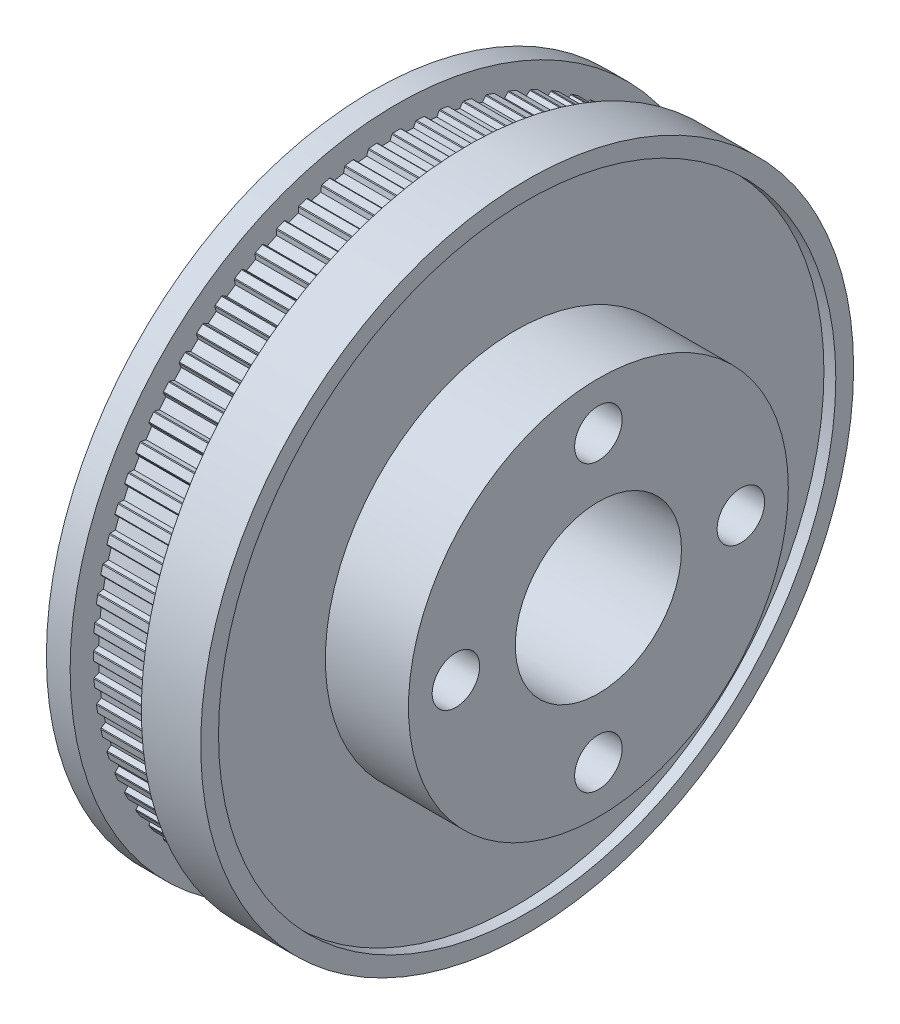
from build123d import *

# Parameters (mm, degrees)
RESSALTO_EXTRUS_O1_DEPTH = 6
SKETCH1_R                = 27.5
BOSS_EXTRUDE1_DEPTH      = 2
BOSS_EXTRUDE2_START      = 5
SKETCH2_R                = 27.5
BOSS_EXTRUDE2_DEPTH      = 5
SKETCH3_R                = 26
CUT_EXTRUDE4_DEPTH       = 1
SKETCH7_R                = 16
BOSS_EXTRUDE4_DEPTH      = 7
SKETCH5_R                = 2
CUT_EXTRUDE2_DEPTH       = 42.006097108
CIRPATTERN1_COUNT        = 4
SKETCH8_R                = 7
CUT_EXTRUDE5_DEPTH       = 44.283946216


with BuildPart() as part:
    # Esboço2 → Ressalto-extrusão1 (new body)
    with BuildSketch(Plane(origin=(0, 0, 0), x_dir=(0, 0, -1), z_dir=(1, 0, 0))):
        with BuildLine():
            ThreePointArc((0.33567243, 25.542794464), (0.167839838, 25.54444861), (0, 25.545))
            ThreePointArc((0, 25.545), (-0.165291878, 25.544465224), (-0.330576835, 25.54286092))
            Line((-0.330576835, 25.54286092), (-0.394918285, 25.498131943))
            Line((-0.394918285, 25.498131943), (-0.545457785, 25.093070513))
            Line((-0.545457785, 25.093070513), (-1.419487303, 25.057354241))
            Line((-1.419487303, 25.057354241), (-1.601874904, 25.450906938))
            Line((-1.601874904, 25.450906938), (-1.672762577, 25.492340818))
            Line((-1.672762577, 25.492340818), (-2.330728018, 25.440557814))
            Line((-2.330728018, 25.440557814), (-2.394261259, 25.38854478))
            Line((-2.394261259, 25.38854478), (-2.512555942, 24.972920826))
            Line((-2.512555942, 24.972920826), (-3.381088853, 24.868739091))
            Line((-3.381088853, 24.868739091), (-3.593792003, 25.24676863))
            Line((-3.593792003, 25.24676863), (-3.667712017, 25.282512999))
            Line((-3.667712017, 25.282512999), (-4.319586322, 25.179266252))
            Line((-4.319586322, 25.179266252), (-4.378842816, 25.122428796))
            Line((-4.378842816, 25.122428796), (-4.464163356, 24.698804779))
            Line((-4.464163356, 24.698804779), (-5.321844865, 24.526799893))
            Line((-5.321844865, 24.526799893), (-5.563552178, 24.886975597))
            Line((-5.563552178, 24.886975597), (-5.640048793, 24.916810081))
            Line((-5.640048793, 24.916810081), (-6.28181294, 24.762736141))
            Line((-6.28181294, 24.762736141), (-6.336427351, 24.701424684))
            Line((-6.336427351, 24.701424684), (-6.388247719, 24.272412386))
            Line((-6.388247719, 24.272412386), (-7.229789934, 24.033644819))
            Line((-7.229789934, 24.033644819), (-7.499011204, 24.373746084))
            Line((-7.499011204, 24.373746084), (-7.577612792, 24.397486743))
            Line((-7.577612792, 24.397486743), (-8.205310093, 24.193535527))
            Line((-8.205310093, 24.193535527), (-8.254945704, 24.128128076))
            Line((-8.254945704, 24.128128076), (-8.27294641, 23.6963725))
            Line((-8.27294641, 23.6963725), (-9.093160944, 23.392314332))
            Line((-9.093160944, 23.392314332), (-9.388236332, 23.710244321))
            Line((-9.388236332, 23.710244321), (-9.468458288, 23.727744786))
            Line((-9.468458288, 23.727744786), (-10.07821878, 23.475173721))
            Line((-10.07821878, 23.475173721), (-10.122569571, 23.406073534))
            Line((-10.122569571, 23.406073534), (-10.106639636, 22.974236597))
            Line((-10.106639636, 22.974236597), (-10.900469593, 22.606762449))
            Line((-10.900469593, 22.606762449), (-11.219579862, 22.900561018))
            Line((-11.219579862, 22.900561018), (-11.300927591, 22.911713393))
            Line((-11.300927591, 22.911713393), (-11.888991897, 22.612079663))
            Line((-11.888991897, 22.612079663), (-11.927784432, 22.539712766))
            Line((-11.927784432, 22.539712766), (-11.878022067, 22.110456887))
            Line((-11.878022067, 22.110456887), (-12.640573222, 21.681832358))
            Line((-12.640573222, 21.681832358), (-12.981750951, 21.94968814))
            Line((-12.981750951, 21.94968814), (-13.063722917, 21.954423667))
            Line((-13.063722917, 21.954423667), (-13.626465426, 21.609574614))
            Line((-13.626465426, 21.609574614), (-13.659460535, 21.534387173))
            Line((-13.659460535, 21.534387173), (-13.576172543, 21.110358857))
            Line((-13.576172543, 21.110358857), (-14.302743514, 20.62322656))
            Line((-14.302743514, 20.62322656), (-14.663885228, 20.863488136))
            Line((-14.663885228, 20.863488136), (-14.745976047, 20.861777619))
            Line((-14.745976047, 20.861777619), (-15.279927264, 20.473839352))
            Line((-15.279927264, 20.473839352), (-15.306921521, 20.396294922))
            Line((-15.306921521, 20.396294922), (-15.1906214, 19.980108444))
            Line((-15.1906214, 19.980108444), (-15.876732636, 19.437471713))
            Line((-15.876732636, 19.437471713), (-16.255611776, 19.648657791))
            Line((-16.255611776, 19.648657791), (-16.337315332, 19.640511774))
            Line((-16.337315332, 19.640511774), (-16.839183269, 19.211876062))
            Line((-16.839183269, 19.211876062), (-16.860010246, 19.132452731))
            Line((-16.860010246, 19.132452731), (-16.711415025, 18.72667402))
            Line((-16.711415025, 18.72667402), (-17.352836422, 18.131878389))
            Line((-17.352836422, 18.131878389), (-17.747117073, 18.312686936))
            Line((-17.747117073, 18.312686936), (-17.827929634, 18.298155644))
            Line((-17.827929634, 18.298155644), (-18.29462011, 17.831465168))
            Line((-18.29462011, 17.831465168), (-18.309151402, 17.750652607))
            Line((-18.309151402, 17.750652607), (-18.129177219, 17.357783422))
            Line((-18.129177219, 17.357783422), (-18.721954201, 16.714496005))
            Line((-18.721954201, 16.714496005), (-19.129205491, 16.863812276))
            Line((-19.129205491, 16.863812276), (-19.208628822, 16.842985299))
            Line((-19.208628822, 16.842985299), (-19.637264534, 16.341117361))
            Line((-19.637264534, 16.341117361), (-19.64541055, 16.259413806))
            Line((-19.64541055, 16.259413806), (-19.435167007, 15.881876318))
            Line((-19.435167007, 15.881876318), (-19.975644906, 15.194063195))
            Line((-19.975644906, 15.194063195), (-20.393355996, 15.310966606))
            Line((-20.393355996, 15.310966606), (-20.470900426, 15.283972349))
            Line((-20.470900426, 15.283972349), (-20.858838692, 14.750021132))
            Line((-20.858838692, 14.750021132), (-20.86054921, 14.667930313))
            Line((-20.86054921, 14.667930313), (-20.621332528, 14.308052165))
            Line((-20.621332528, 14.308052165), (-21.106179118, 13.579953933))
            Line((-21.106179118, 13.579953933), (-21.53177468, 13.663723735))
            Line((-21.53177468, 13.663723735), (-21.606962121, 13.630728626))
            Line((-21.606962121, 13.630728626), (-21.951811174, 13.067986118))
            Line((-21.951811174, 13.067986118), (-21.947075647, 12.986014151))
            Line((-21.947075647, 12.986014151), (-21.680360676, 12.646014112))
            Line((-21.680360676, 12.646014112), (-22.106586717, 11.882119739))
            Line((-22.106586717, 11.882119739), (-22.537442813, 11.932239464))
            Line((-22.537442813, 11.932239464), (-22.60980971, 11.89344693))
            Line((-22.60980971, 11.89344693), (-22.90944344, 11.305382624))
            Line((-22.90944344, 11.305382624), (-22.898291065, 11.224034894))
            Line((-22.898291065, 11.224034894), (-22.605722191, 10.906009177))
            Line((-22.605722191, 10.906009177), (-22.970699858, 10.111028326))
            Line((-22.970699858, 10.111028326), (-23.404160117, 10.127188969))
            Line((-23.404160117, 10.127188969), (-23.473260304, 10.082838178))
            Line((-23.473260304, 10.082838178), (-23.725831369, 9.473077686))
            Line((-23.725831369, 9.473077686), (-23.708330904, 9.39285573))
            Line((-23.708330904, 9.39285573), (-23.391711912, 9.098765069))
            Line((-23.391711912, 9.098765069), (-23.693190996, 8.277599061))
            Line((-23.693190996, 8.277599061), (-24.126582991, 8.259700986))
            Line((-24.126582991, 8.259700986), (-24.191990442, 8.210065375))
            Line((-24.191990442, 8.210065375), (-24.395941658, 7.582368074))
            Line((-24.395941658, 7.582368074), (-24.372200999, 7.503766487))
            Line((-24.372200999, 7.503766487), (-24.03348395, 7.235424049))
            Line((-24.03348395, 7.235424049), (-24.269605732, 6.393135645))
            Line((-24.269605732, 6.393135645), (-24.700257458, 6.3412892))
            Line((-24.700257458, 6.3412892), (-24.761568914, 6.28667479))
            Line((-24.761568914, 6.28667479), (-24.915642854, 5.644910642))
            Line((-24.915642854, 5.644910642), (-24.88580837, 5.568414027))
            Line((-24.88580837, 5.568414027), (-24.527081568, 5.327474233))
            Line((-24.527081568, 5.327474233), (-24.696390279, 4.469256422))
            Line((-24.696390279, 4.469256422), (-25.121646624, 4.383781257))
            Line((-25.121646624, 4.383781257), (-25.17848408, 4.324524764))
            Line((-25.17848408, 4.324524764), (-25.281730827, 3.672650459))
            Line((-25.281730827, 3.672650459), (-25.245986457, 3.598730444))
            Line((-25.245986457, 3.598730444), (-24.869461572, 3.386678768))
            Line((-24.869461572, 3.386678768), (-24.970913367, 2.517822747))
            Line((-24.970913367, 2.517822747), (-25.388152484, 2.399245846))
            Line((-25.388152484, 2.399245846), (-25.440165519, 2.335712604))
            Line((-25.440165519, 2.335712604), (-25.491948522, 1.677747164))
            Line((-25.491948522, 1.677747164), (-25.450514643, 1.606859491))
            Line((-25.450514643, 1.606859491), (-25.058513075, 1.425003301))
            Line((-25.058513075, 1.425003301), (-25.091482471, 0.550865858))
            Line((-25.091482471, 0.550865858), (-25.498131943, 0.399918285))
            Line((-25.498131943, 0.399918285), (-25.544999878, 0.3325))
            Line((-25.544999878, 0.3325), (-25.544999878, -0.3275))
            Line((-25.544999878, -0.3275), (-25.498131943, -0.394918285))
            Line((-25.498131943, -0.394918285), (-25.093070513, -0.545457785))
            Line((-25.093070513, -0.545457785), (-25.057354241, -1.419487303))
            Line((-25.057354241, -1.419487303), (-25.450906938, -1.601874904))
            Line((-25.450906938, -1.601874904), (-25.492340818, -1.672762577))
            Line((-25.492340818, -1.672762577), (-25.440557814, -2.330728018))
            Line((-25.440557814, -2.330728018), (-25.38854478, -2.394261259))
            Line((-25.38854478, -2.394261259), (-24.972920826, -2.512555942))
            Line((-24.972920826, -2.512555942), (-24.868739091, -3.381088853))
            Line((-24.868739091, -3.381088853), (-25.24676863, -3.593792003))
            Line((-25.24676863, -3.593792003), (-25.282512999, -3.667712017))
            Line((-25.282512999, -3.667712017), (-25.179266252, -4.319586322))
            Line((-25.179266252, -4.319586322), (-25.122428796, -4.378842816))
            Line((-25.122428796, -4.378842816), (-24.698804779, -4.464163356))
            Line((-24.698804779, -4.464163356), (-24.526799893, -5.321844865))
            Line((-24.526799893, -5.321844865), (-24.886975597, -5.563552178))
            Line((-24.886975597, -5.563552178), (-24.916810081, -5.640048793))
            Line((-24.916810081, -5.640048793), (-24.762736141, -6.28181294))
            Line((-24.762736141, -6.28181294), (-24.701424684, -6.336427351))
            Line((-24.701424684, -6.336427351), (-24.272412386, -6.388247719))
            Line((-24.272412386, -6.388247719), (-24.033644819, -7.229789934))
            Line((-24.033644819, -7.229789934), (-24.373746084, -7.499011204))
            Line((-24.373746084, -7.499011204), (-24.397486743, -7.577612792))
            Line((-24.397486743, -7.577612792), (-24.193535527, -8.205310093))
            Line((-24.193535527, -8.205310093), (-24.128128076, -8.254945704))
            Line((-24.128128076, -8.254945704), (-23.6963725, -8.27294641))
            Line((-23.6963725, -8.27294641), (-23.392314332, -9.093160944))
            Line((-23.392314332, -9.093160944), (-23.710244321, -9.388236332))
            Line((-23.710244321, -9.388236332), (-23.727744786, -9.468458288))
            Line((-23.727744786, -9.468458288), (-23.475173721, -10.07821878))
            Line((-23.475173721, -10.07821878), (-23.406073534, -10.122569571))
            Line((-23.406073534, -10.122569571), (-22.974236597, -10.106639636))
            Line((-22.974236597, -10.106639636), (-22.606762449, -10.900469593))
            Line((-22.606762449, -10.900469593), (-22.900561018, -11.219579862))
            Line((-22.900561018, -11.219579862), (-22.911713393, -11.300927591))
            Line((-22.911713393, -11.300927591), (-22.612079663, -11.888991897))
            Line((-22.612079663, -11.888991897), (-22.539712766, -11.927784432))
            Line((-22.539712766, -11.927784432), (-22.110456887, -11.878022067))
            Line((-22.110456887, -11.878022067), (-21.681832358, -12.640573222))
            Line((-21.681832358, -12.640573222), (-21.94968814, -12.981750951))
            Line((-21.94968814, -12.981750951), (-21.954423667, -13.063722917))
            Line((-21.954423667, -13.063722917), (-21.609574614, -13.626465426))
            Line((-21.609574614, -13.626465426), (-21.534387173, -13.659460535))
            Line((-21.534387173, -13.659460535), (-21.110358857, -13.576172543))
            Line((-21.110358857, -13.576172543), (-20.62322656, -14.302743514))
            Line((-20.62322656, -14.302743514), (-20.863488136, -14.663885228))
            Line((-20.863488136, -14.663885228), (-20.861777619, -14.745976047))
            Line((-20.861777619, -14.745976047), (-20.473839352, -15.279927264))
            Line((-20.473839352, -15.279927264), (-20.396294922, -15.306921521))
            Line((-20.396294922, -15.306921521), (-19.980108444, -15.1906214))
            Line((-19.980108444, -15.1906214), (-19.437471713, -15.876732636))
            Line((-19.437471713, -15.876732636), (-19.648657791, -16.255611776))
            Line((-19.648657791, -16.255611776), (-19.640511774, -16.337315332))
            Line((-19.640511774, -16.337315332), (-19.211876062, -16.839183269))
            Line((-19.211876062, -16.839183269), (-19.132452731, -16.860010246))
            Line((-19.132452731, -16.860010246), (-18.72667402, -16.711415025))
            Line((-18.72667402, -16.711415025), (-18.131878389, -17.352836422))
            Line((-18.131878389, -17.352836422), (-18.312686936, -17.747117073))
            Line((-18.312686936, -17.747117073), (-18.298155644, -17.827929634))
            Line((-18.298155644, -17.827929634), (-17.831465168, -18.29462011))
            Line((-17.831465168, -18.29462011), (-17.750652607, -18.309151402))
            Line((-17.750652607, -18.309151402), (-17.357783422, -18.129177219))
            Line((-17.357783422, -18.129177219), (-16.714496005, -18.721954201))
            Line((-16.714496005, -18.721954201), (-16.863812276, -19.129205491))
            Line((-16.863812276, -19.129205491), (-16.842985299, -19.208628822))
            Line((-16.842985299, -19.208628822), (-16.341117361, -19.637264534))
            Line((-16.341117361, -19.637264534), (-16.259413806, -19.64541055))
            Line((-16.259413806, -19.64541055), (-15.881876318, -19.435167007))
            Line((-15.881876318, -19.435167007), (-15.194063195, -19.975644906))
            Line((-15.194063195, -19.975644906), (-15.310966606, -20.393355996))
            Line((-15.310966606, -20.393355996), (-15.283972349, -20.470900426))
            Line((-15.283972349, -20.470900426), (-14.750021132, -20.858838692))
            Line((-14.750021132, -20.858838692), (-14.667930313, -20.86054921))
            Line((-14.667930313, -20.86054921), (-14.308052165, -20.621332528))
            Line((-14.308052165, -20.621332528), (-13.579953933, -21.106179118))
            Line((-13.579953933, -21.106179118), (-13.663723735, -21.53177468))
            Line((-13.663723735, -21.53177468), (-13.630728626, -21.606962121))
            Line((-13.630728626, -21.606962121), (-13.067986118, -21.951811174))
            Line((-13.067986118, -21.951811174), (-12.986014151, -21.947075647))
            Line((-12.986014151, -21.947075647), (-12.646014112, -21.680360676))
            Line((-12.646014112, -21.680360676), (-11.882119739, -22.106586717))
            Line((-11.882119739, -22.106586717), (-11.932239464, -22.537442813))
            Line((-11.932239464, -22.537442813), (-11.89344693, -22.60980971))
            Line((-11.89344693, -22.60980971), (-11.305382624, -22.90944344))
            Line((-11.305382624, -22.90944344), (-11.224034894, -22.898291065))
            Line((-11.224034894, -22.898291065), (-10.906009177, -22.605722191))
            Line((-10.906009177, -22.605722191), (-10.111028326, -22.970699858))
            Line((-10.111028326, -22.970699858), (-10.127188969, -23.404160117))
            Line((-10.127188969, -23.404160117), (-10.082838178, -23.473260304))
            Line((-10.082838178, -23.473260304), (-9.473077686, -23.725831369))
            Line((-9.473077686, -23.725831369), (-9.39285573, -23.708330904))
            Line((-9.39285573, -23.708330904), (-9.098765069, -23.391711912))
            Line((-9.098765069, -23.391711912), (-8.277599061, -23.693190996))
            Line((-8.277599061, -23.693190996), (-8.259700986, -24.126582991))
            Line((-8.259700986, -24.126582991), (-8.210065375, -24.191990442))
            Line((-8.210065375, -24.191990442), (-7.582368074, -24.395941658))
            Line((-7.582368074, -24.395941658), (-7.503766487, -24.372200999))
            Line((-7.503766487, -24.372200999), (-7.235424049, -24.03348395))
            Line((-7.235424049, -24.03348395), (-6.393135645, -24.269605732))
            Line((-6.393135645, -24.269605732), (-6.3412892, -24.700257458))
            Line((-6.3412892, -24.700257458), (-6.28667479, -24.761568914))
            Line((-6.28667479, -24.761568914), (-5.644910642, -24.915642854))
            Line((-5.644910642, -24.915642854), (-5.568414027, -24.88580837))
            Line((-5.568414027, -24.88580837), (-5.327474233, -24.527081568))
            Line((-5.327474233, -24.527081568), (-4.469256422, -24.696390279))
            Line((-4.469256422, -24.696390279), (-4.383781257, -25.121646624))
            Line((-4.383781257, -25.121646624), (-4.324524764, -25.17848408))
            Line((-4.324524764, -25.17848408), (-3.672650459, -25.281730827))
            Line((-3.672650459, -25.281730827), (-3.598730444, -25.245986457))
            Line((-3.598730444, -25.245986457), (-3.386678768, -24.869461572))
            Line((-3.386678768, -24.869461572), (-2.517822747, -24.970913367))
            Line((-2.517822747, -24.970913367), (-2.399245846, -25.388152484))
            Line((-2.399245846, -25.388152484), (-2.335712604, -25.440165519))
            Line((-2.335712604, -25.440165519), (-1.677747164, -25.491948522))
            Line((-1.677747164, -25.491948522), (-1.606859491, -25.450514643))
            Line((-1.606859491, -25.450514643), (-1.425003301, -25.058513075))
            Line((-1.425003301, -25.058513075), (-0.550865858, -25.091482471))
            Line((-0.550865858, -25.091482471), (-0.399918285, -25.498131943))
            Line((-0.399918285, -25.498131943), (-0.3325, -25.544999878))
            Line((-0.3325, -25.544999878), (0.3275, -25.544999878))
            Line((0.3275, -25.544999878), (0.394918285, -25.498131943))
            Line((0.394918285, -25.498131943), (0.545457785, -25.093070513))
            Line((0.545457785, -25.093070513), (1.419487303, -25.057354241))
            Line((1.419487303, -25.057354241), (1.601874904, -25.450906938))
            Line((1.601874904, -25.450906938), (1.672762577, -25.492340818))
            Line((1.672762577, -25.492340818), (2.330728018, -25.440557814))
            Line((2.330728018, -25.440557814), (2.394261259, -25.38854478))
            Line((2.394261259, -25.38854478), (2.512555942, -24.972920826))
            Line((2.512555942, -24.972920826), (3.381088853, -24.868739091))
            Line((3.381088853, -24.868739091), (3.593792003, -25.24676863))
            Line((3.593792003, -25.24676863), (3.667712017, -25.282512999))
            Line((3.667712017, -25.282512999), (4.319586322, -25.179266252))
            Line((4.319586322, -25.179266252), (4.378842816, -25.122428796))
            Line((4.378842816, -25.122428796), (4.464163356, -24.698804779))
            Line((4.464163356, -24.698804779), (5.321844865, -24.526799893))
            Line((5.321844865, -24.526799893), (5.563552178, -24.886975597))
            Line((5.563552178, -24.886975597), (5.640048793, -24.916810081))
            Line((5.640048793, -24.916810081), (6.28181294, -24.762736141))
            Line((6.28181294, -24.762736141), (6.336427351, -24.701424684))
            Line((6.336427351, -24.701424684), (6.388247719, -24.272412386))
            Line((6.388247719, -24.272412386), (7.229789934, -24.033644819))
            Line((7.229789934, -24.033644819), (7.499011204, -24.373746084))
            Line((7.499011204, -24.373746084), (7.577612792, -24.397486743))
            Line((7.577612792, -24.397486743), (8.205310093, -24.193535527))
            Line((8.205310093, -24.193535527), (8.254945704, -24.128128076))
            Line((8.254945704, -24.128128076), (8.27294641, -23.6963725))
            Line((8.27294641, -23.6963725), (9.093160944, -23.392314332))
            Line((9.093160944, -23.392314332), (9.388236332, -23.710244321))
            Line((9.388236332, -23.710244321), (9.468458288, -23.727744786))
            Line((9.468458288, -23.727744786), (10.07821878, -23.475173721))
            Line((10.07821878, -23.475173721), (10.122569571, -23.406073534))
            Line((10.122569571, -23.406073534), (10.106639636, -22.974236597))
            Line((10.106639636, -22.974236597), (10.900469593, -22.606762449))
            Line((10.900469593, -22.606762449), (11.219579862, -22.900561018))
            Line((11.219579862, -22.900561018), (11.300927591, -22.911713393))
            Line((11.300927591, -22.911713393), (11.888991897, -22.612079663))
            Line((11.888991897, -22.612079663), (11.927784432, -22.539712766))
            Line((11.927784432, -22.539712766), (11.878022067, -22.110456887))
            Line((11.878022067, -22.110456887), (12.640573222, -21.681832358))
            Line((12.640573222, -21.681832358), (12.981750951, -21.94968814))
            Line((12.981750951, -21.94968814), (13.063722917, -21.954423667))
            Line((13.063722917, -21.954423667), (13.626465426, -21.609574614))
            Line((13.626465426, -21.609574614), (13.659460535, -21.534387173))
            Line((13.659460535, -21.534387173), (13.576172543, -21.110358857))
            Line((13.576172543, -21.110358857), (14.302743514, -20.62322656))
            Line((14.302743514, -20.62322656), (14.663885228, -20.863488136))
            Line((14.663885228, -20.863488136), (14.745976047, -20.861777619))
            Line((14.745976047, -20.861777619), (15.279927264, -20.473839352))
            Line((15.279927264, -20.473839352), (15.306921521, -20.396294922))
            Line((15.306921521, -20.396294922), (15.1906214, -19.980108444))
            Line((15.1906214, -19.980108444), (15.876732636, -19.437471713))
            Line((15.876732636, -19.437471713), (16.255611776, -19.648657791))
            Line((16.255611776, -19.648657791), (16.337315332, -19.640511774))
            Line((16.337315332, -19.640511774), (16.839183269, -19.211876062))
            Line((16.839183269, -19.211876062), (16.860010246, -19.132452731))
            Line((16.860010246, -19.132452731), (16.711415025, -18.72667402))
            Line((16.711415025, -18.72667402), (17.352836422, -18.131878389))
            Line((17.352836422, -18.131878389), (17.747117073, -18.312686936))
            Line((17.747117073, -18.312686936), (17.827929634, -18.298155644))
            Line((17.827929634, -18.298155644), (18.29462011, -17.831465168))
            Line((18.29462011, -17.831465168), (18.309151402, -17.750652607))
            Line((18.309151402, -17.750652607), (18.129177219, -17.357783422))
            Line((18.129177219, -17.357783422), (18.721954201, -16.714496005))
            Line((18.721954201, -16.714496005), (19.129205491, -16.863812276))
            Line((19.129205491, -16.863812276), (19.208628822, -16.842985299))
            Line((19.208628822, -16.842985299), (19.637264534, -16.341117361))
            Line((19.637264534, -16.341117361), (19.64541055, -16.259413806))
            Line((19.64541055, -16.259413806), (19.435167007, -15.881876318))
            Line((19.435167007, -15.881876318), (19.975644906, -15.194063195))
            Line((19.975644906, -15.194063195), (20.393355996, -15.310966606))
            Line((20.393355996, -15.310966606), (20.470900426, -15.283972349))
            Line((20.470900426, -15.283972349), (20.858838692, -14.750021132))
            Line((20.858838692, -14.750021132), (20.86054921, -14.667930313))
            Line((20.86054921, -14.667930313), (20.621332528, -14.308052165))
            Line((20.621332528, -14.308052165), (21.106179118, -13.579953933))
            Line((21.106179118, -13.579953933), (21.53177468, -13.663723735))
            Line((21.53177468, -13.663723735), (21.606962121, -13.630728626))
            Line((21.606962121, -13.630728626), (21.951811174, -13.067986118))
            Line((21.951811174, -13.067986118), (21.947075647, -12.986014151))
            Line((21.947075647, -12.986014151), (21.680360676, -12.646014112))
            Line((21.680360676, -12.646014112), (22.106586717, -11.882119739))
            Line((22.106586717, -11.882119739), (22.537442813, -11.932239464))
            Line((22.537442813, -11.932239464), (22.60980971, -11.89344693))
            Line((22.60980971, -11.89344693), (22.90944344, -11.305382624))
            Line((22.90944344, -11.305382624), (22.898291065, -11.224034894))
            Line((22.898291065, -11.224034894), (22.605722191, -10.906009177))
            Line((22.605722191, -10.906009177), (22.970699858, -10.111028326))
            Line((22.970699858, -10.111028326), (23.404160117, -10.127188969))
            Line((23.404160117, -10.127188969), (23.473260304, -10.082838178))
            Line((23.473260304, -10.082838178), (23.725831369, -9.473077686))
            Line((23.725831369, -9.473077686), (23.708330904, -9.39285573))
            Line((23.708330904, -9.39285573), (23.391711912, -9.098765069))
            Line((23.391711912, -9.098765069), (23.693190996, -8.277599061))
            Line((23.693190996, -8.277599061), (24.126582991, -8.259700986))
            Line((24.126582991, -8.259700986), (24.191990442, -8.210065375))
            Line((24.191990442, -8.210065375), (24.395941658, -7.582368074))
            Line((24.395941658, -7.582368074), (24.372200999, -7.503766487))
            Line((24.372200999, -7.503766487), (24.03348395, -7.235424049))
            Line((24.03348395, -7.235424049), (24.269605732, -6.393135645))
            Line((24.269605732, -6.393135645), (24.700257458, -6.3412892))
            Line((24.700257458, -6.3412892), (24.761568914, -6.28667479))
            Line((24.761568914, -6.28667479), (24.915642854, -5.644910642))
            Line((24.915642854, -5.644910642), (24.88580837, -5.568414027))
            Line((24.88580837, -5.568414027), (24.527081568, -5.327474233))
            Line((24.527081568, -5.327474233), (24.696390279, -4.469256422))
            Line((24.696390279, -4.469256422), (25.121646624, -4.383781257))
            Line((25.121646624, -4.383781257), (25.17848408, -4.324524764))
            Line((25.17848408, -4.324524764), (25.281730827, -3.672650459))
            Line((25.281730827, -3.672650459), (25.245986457, -3.598730444))
            Line((25.245986457, -3.598730444), (24.869461572, -3.386678768))
            Line((24.869461572, -3.386678768), (24.970913367, -2.517822747))
            Line((24.970913367, -2.517822747), (25.388152484, -2.399245846))
            Line((25.388152484, -2.399245846), (25.440165519, -2.335712604))
            Line((25.440165519, -2.335712604), (25.491948522, -1.677747164))
            Line((25.491948522, -1.677747164), (25.450514643, -1.606859491))
            Line((25.450514643, -1.606859491), (25.058513075, -1.425003301))
            Line((25.058513075, -1.425003301), (25.091482471, -0.550865858))
            Line((25.091482471, -0.550865858), (25.498131943, -0.399918285))
            Line((25.498131943, -0.399918285), (25.544999878, -0.3325))
            Line((25.544999878, -0.3325), (25.544999878, 0.3275))
            Line((25.544999878, 0.3275), (25.498131943, 0.394918285))
            Line((25.498131943, 0.394918285), (25.093070513, 0.545457785))
            Line((25.093070513, 0.545457785), (25.057354241, 1.419487303))
            Line((25.057354241, 1.419487303), (25.450906938, 1.601874904))
            Line((25.450906938, 1.601874904), (25.492340818, 1.672762577))
            Line((25.492340818, 1.672762577), (25.440557814, 2.330728018))
            Line((25.440557814, 2.330728018), (25.38854478, 2.394261259))
            Line((25.38854478, 2.394261259), (24.972920826, 2.512555942))
            Line((24.972920826, 2.512555942), (24.868739091, 3.381088853))
            Line((24.868739091, 3.381088853), (25.24676863, 3.593792003))
            Line((25.24676863, 3.593792003), (25.282512999, 3.667712017))
            Line((25.282512999, 3.667712017), (25.179266252, 4.319586322))
            Line((25.179266252, 4.319586322), (25.122428796, 4.378842816))
            Line((25.122428796, 4.378842816), (24.698804779, 4.464163356))
            Line((24.698804779, 4.464163356), (24.526799893, 5.321844865))
            Line((24.526799893, 5.321844865), (24.886975597, 5.563552178))
            Line((24.886975597, 5.563552178), (24.916810081, 5.640048793))
            Line((24.916810081, 5.640048793), (24.762736141, 6.28181294))
            Line((24.762736141, 6.28181294), (24.701424684, 6.336427351))
            Line((24.701424684, 6.336427351), (24.272412386, 6.388247719))
            Line((24.272412386, 6.388247719), (24.033644819, 7.229789934))
            Line((24.033644819, 7.229789934), (24.373746084, 7.499011204))
            Line((24.373746084, 7.499011204), (24.397486743, 7.577612792))
            Line((24.397486743, 7.577612792), (24.193535527, 8.205310093))
            Line((24.193535527, 8.205310093), (24.128128076, 8.254945704))
            Line((24.128128076, 8.254945704), (23.6963725, 8.27294641))
            Line((23.6963725, 8.27294641), (23.392314332, 9.093160944))
            Line((23.392314332, 9.093160944), (23.710244321, 9.388236332))
            Line((23.710244321, 9.388236332), (23.727744786, 9.468458288))
            Line((23.727744786, 9.468458288), (23.475173721, 10.07821878))
            Line((23.475173721, 10.07821878), (23.406073534, 10.122569571))
            Line((23.406073534, 10.122569571), (22.974236597, 10.106639636))
            Line((22.974236597, 10.106639636), (22.606762449, 10.900469593))
            Line((22.606762449, 10.900469593), (22.900561018, 11.219579862))
            Line((22.900561018, 11.219579862), (22.911713393, 11.300927591))
            Line((22.911713393, 11.300927591), (22.612079663, 11.888991897))
            Line((22.612079663, 11.888991897), (22.539712766, 11.927784432))
            Line((22.539712766, 11.927784432), (22.110456887, 11.878022067))
            Line((22.110456887, 11.878022067), (21.681832358, 12.640573222))
            Line((21.681832358, 12.640573222), (21.94968814, 12.981750951))
            Line((21.94968814, 12.981750951), (21.954423667, 13.063722917))
            Line((21.954423667, 13.063722917), (21.609574614, 13.626465426))
            Line((21.609574614, 13.626465426), (21.534387173, 13.659460535))
            Line((21.534387173, 13.659460535), (21.110358857, 13.576172543))
            Line((21.110358857, 13.576172543), (20.62322656, 14.302743514))
            Line((20.62322656, 14.302743514), (20.863488136, 14.663885228))
            Line((20.863488136, 14.663885228), (20.861777619, 14.745976047))
            Line((20.861777619, 14.745976047), (20.473839352, 15.279927264))
            Line((20.473839352, 15.279927264), (20.396294922, 15.306921521))
            Line((20.396294922, 15.306921521), (19.980108444, 15.1906214))
            Line((19.980108444, 15.1906214), (19.437471713, 15.876732636))
            Line((19.437471713, 15.876732636), (19.648657791, 16.255611776))
            Line((19.648657791, 16.255611776), (19.640511774, 16.337315332))
            Line((19.640511774, 16.337315332), (19.211876062, 16.839183269))
            Line((19.211876062, 16.839183269), (19.132452731, 16.860010246))
            Line((19.132452731, 16.860010246), (18.72667402, 16.711415025))
            Line((18.72667402, 16.711415025), (18.131878389, 17.352836422))
            Line((18.131878389, 17.352836422), (18.312686936, 17.747117073))
            Line((18.312686936, 17.747117073), (18.298155644, 17.827929634))
            Line((18.298155644, 17.827929634), (17.831465168, 18.29462011))
            Line((17.831465168, 18.29462011), (17.750652607, 18.309151402))
            Line((17.750652607, 18.309151402), (17.357783422, 18.129177219))
            Line((17.357783422, 18.129177219), (16.714496005, 18.721954201))
            Line((16.714496005, 18.721954201), (16.863812276, 19.129205491))
            Line((16.863812276, 19.129205491), (16.842985299, 19.208628822))
            Line((16.842985299, 19.208628822), (16.341117361, 19.637264534))
            Line((16.341117361, 19.637264534), (16.259413806, 19.64541055))
            Line((16.259413806, 19.64541055), (15.881876318, 19.435167007))
            Line((15.881876318, 19.435167007), (15.194063195, 19.975644906))
            Line((15.194063195, 19.975644906), (15.310966606, 20.393355996))
            Line((15.310966606, 20.393355996), (15.283972349, 20.470900426))
            Line((15.283972349, 20.470900426), (14.750021132, 20.858838692))
            Line((14.750021132, 20.858838692), (14.667930313, 20.86054921))
            Line((14.667930313, 20.86054921), (14.308052165, 20.621332528))
            Line((14.308052165, 20.621332528), (13.579953933, 21.106179118))
            Line((13.579953933, 21.106179118), (13.663723735, 21.53177468))
            Line((13.663723735, 21.53177468), (13.630728626, 21.606962121))
            Line((13.630728626, 21.606962121), (13.067986118, 21.951811174))
            Line((13.067986118, 21.951811174), (12.986014151, 21.947075647))
            Line((12.986014151, 21.947075647), (12.646014112, 21.680360676))
            Line((12.646014112, 21.680360676), (11.882119739, 22.106586717))
            Line((11.882119739, 22.106586717), (11.932239464, 22.537442813))
            Line((11.932239464, 22.537442813), (11.89344693, 22.60980971))
            Line((11.89344693, 22.60980971), (11.305382624, 22.90944344))
            Line((11.305382624, 22.90944344), (11.224034894, 22.898291065))
            Line((11.224034894, 22.898291065), (10.906009177, 22.605722191))
            Line((10.906009177, 22.605722191), (10.111028326, 22.970699858))
            Line((10.111028326, 22.970699858), (10.127188969, 23.404160117))
            Line((10.127188969, 23.404160117), (10.082838178, 23.473260304))
            Line((10.082838178, 23.473260304), (9.473077686, 23.725831369))
            Line((9.473077686, 23.725831369), (9.39285573, 23.708330904))
            Line((9.39285573, 23.708330904), (9.098765069, 23.391711912))
            Line((9.098765069, 23.391711912), (8.277599061, 23.693190996))
            Line((8.277599061, 23.693190996), (8.259700986, 24.126582991))
            Line((8.259700986, 24.126582991), (8.210065375, 24.191990442))
            Line((8.210065375, 24.191990442), (7.582368074, 24.395941658))
            Line((7.582368074, 24.395941658), (7.503766487, 24.372200999))
            Line((7.503766487, 24.372200999), (7.235424049, 24.03348395))
            Line((7.235424049, 24.03348395), (6.393135645, 24.269605732))
            Line((6.393135645, 24.269605732), (6.3412892, 24.700257458))
            Line((6.3412892, 24.700257458), (6.28667479, 24.761568914))
            Line((6.28667479, 24.761568914), (5.644910642, 24.915642854))
            Line((5.644910642, 24.915642854), (5.568414027, 24.88580837))
            Line((5.568414027, 24.88580837), (5.327474233, 24.527081568))
            Line((5.327474233, 24.527081568), (4.469256422, 24.696390279))
            Line((4.469256422, 24.696390279), (4.383781257, 25.121646624))
            Line((4.383781257, 25.121646624), (4.324524764, 25.17848408))
            Line((4.324524764, 25.17848408), (3.672650459, 25.281730827))
            Line((3.672650459, 25.281730827), (3.598730444, 25.245986457))
            Line((3.598730444, 25.245986457), (3.386678768, 24.869461572))
            Line((3.386678768, 24.869461572), (2.517822747, 24.970913367))
            Line((2.517822747, 24.970913367), (2.399245846, 25.388152484))
            Line((2.399245846, 25.388152484), (2.335712604, 25.440165519))
            Line((2.335712604, 25.440165519), (1.677747164, 25.491948522))
            Line((1.677747164, 25.491948522), (1.606859491, 25.450514643))
            Line((1.606859491, 25.450514643), (1.425003301, 25.058513075))
            Line((1.425003301, 25.058513075), (0.550865858, 25.091482471))
            Line((0.550865858, 25.091482471), (0.399918285, 25.498131943))
            Line((0.399918285, 25.498131943), (0.33567243, 25.542794464))
        make_face()
    extrude(amount=RESSALTO_EXTRUS_O1_DEPTH)

    # Sketch1 → Boss-Extrude1 (add)
    with BuildSketch(Plane.ZY):
        Circle(SKETCH1_R)
    extrude(amount=BOSS_EXTRUDE1_DEPTH)

    # Sketch2 → Boss-Extrude2 (add)
    with BuildSketch(Plane(origin=(6, 0, 0), x_dir=(0, 0, -1), z_dir=(1, 0, 0)).offset(BOSS_EXTRUDE2_START)):
        Circle(SKETCH2_R)
    extrude(amount=-BOSS_EXTRUDE2_DEPTH)

    # Sketch3 → Cut-Extrude4 (cut)
    with BuildSketch(Plane(origin=(11, 0, 0), x_dir=(0, 0, -1), z_dir=(1, 0, 0))):
        Circle(SKETCH3_R)
    extrude(amount=-CUT_EXTRUDE4_DEPTH, mode=Mode.SUBTRACT)

    # Sketch7 → Boss-Extrude4 (add)
    with BuildSketch(Plane(origin=(10, 0, 0), x_dir=(0, 0, -1), z_dir=(1, 0, 0))):
        Circle(SKETCH7_R)
    extrude(amount=BOSS_EXTRUDE4_DEPTH)

    # Sketch5 → Cut-Extrude2 (cut, symmetric)
    with BuildSketch(Plane(origin=(11, 0, 0), x_dir=(0, 0, -1), z_dir=(1, 0, 0))):
        with Locations((0, 12)):
            Circle(SKETCH5_R)
    cut_extrude2 = extrude(amount=CUT_EXTRUDE2_DEPTH, both=True, mode=Mode.SUBTRACT)

    # CirPattern1: Cut-Extrude2 ×4 about axis
    cirpattern1_axis = Axis((11, 0, 0), (1, 0, 0))
    for i in range(1, CIRPATTERN1_COUNT):
        add(cut_extrude2.rotate(cirpattern1_axis, i * 360 / CIRPATTERN1_COUNT), mode=Mode.SUBTRACT)

    # Sketch8 → Cut-Extrude5 (cut, through all)
    with BuildSketch(Plane(origin=(17, 0, 0), x_dir=(0, 0, -1), z_dir=(1, 0, 0))):
        Circle(SKETCH8_R)
    extrude(amount=-CUT_EXTRUDE5_DEPTH, mode=Mode.SUBTRACT)


solid = part.part
